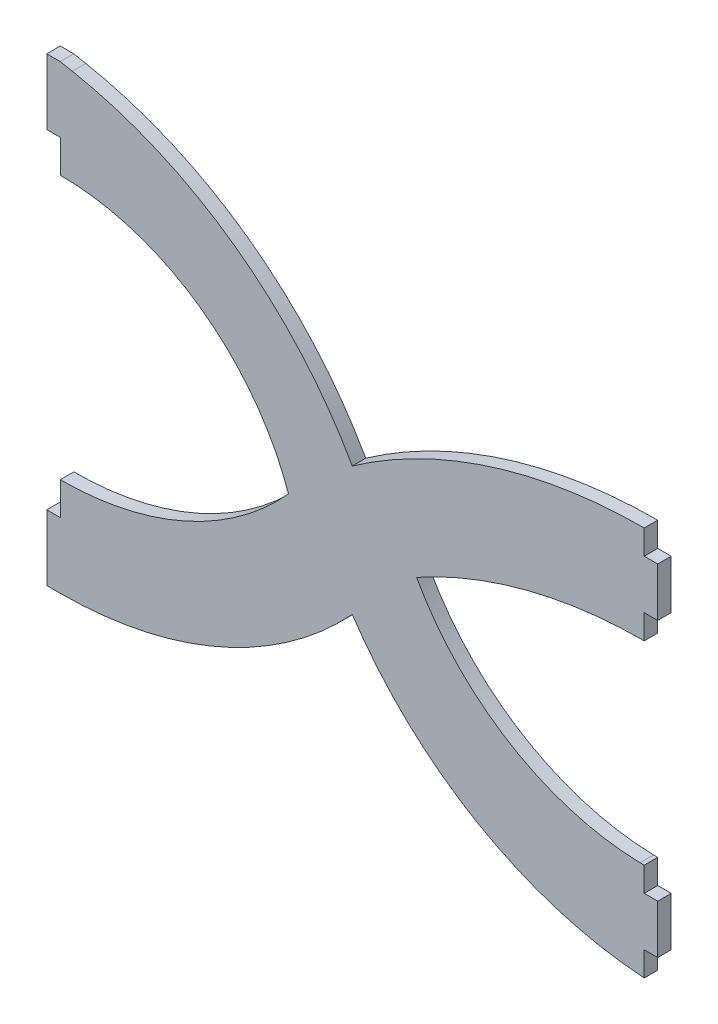
from build123d import *

# Parameters (mm, degrees)
SKETCH1_W           = 241.3
SKETCH1_H           = 198.12
BOSS_EXTRUDE1_DEPTH = 5.334
SKETCH2_W           = 5.334
SKETCH2_H           = 9.652
SKETCH2_H_2         = 96.012
SKETCH2_H_3         = 53.848
CUT_EXTRUDE1_DEPTH  = 179.277190048
SKETCH3_W           = 5.334
SKETCH3_H           = 16.256
SKETCH3_H_2         = 130.048
CUT_EXTRUDE2_DEPTH  = 179.277190048
CUT_EXTRUDE5_DEPTH  = 179.277190048
CUT_EXTRUDE6_DEPTH  = 179.277190048
CUT_EXTRUDE7_DEPTH  = 179.277190048


with BuildPart() as part:
    # Sketch1 → Boss-Extrude1 (new body)
    with BuildSketch(Plane.XY):
        with Locations((-21.329797884, -8.624919689)):
            Rectangle(SKETCH1_W, SKETCH1_H)
    extrude(amount=BOSS_EXTRUDE1_DEPTH)

    # Sketch2 → Cut-Extrude1 (cut, through all)
    with BuildSketch(Plane.XY.offset(5.334)):
        with Locations((96.653202116, -102.858919689)):
            Rectangle(SKETCH2_W, SKETCH2_H)
        with Locations((96.653202116, -30.722919689)):
            Rectangle(SKETCH2_W, SKETCH2_H_2)
        with Locations((96.653202116, 63.511080311)):
            Rectangle(SKETCH2_W, SKETCH2_H_3)
    extrude(amount=-CUT_EXTRUDE1_DEPTH, mode=Mode.SUBTRACT)

    # Sketch3 → Cut-Extrude2 (cut, through all)
    with BuildSketch(Plane.XY.offset(5.334)):
        with Locations((-139.312797884, -99.556919689)):
            Rectangle(SKETCH3_W, SKETCH3_H)
        with Locations((-139.312797884, -0.496919689)):
            Rectangle(SKETCH3_W, SKETCH3_H_2)
    extrude(amount=-CUT_EXTRUDE2_DEPTH, mode=Mode.SUBTRACT)

    # Sketch5 → Cut-Extrude5 (cut, through all)
    with BuildSketch(Plane.XY.offset(5.334)):
        Polygon((-136.645797884, -91.428919689), (93.986202116, -107.684919689), (93.986202116, -162.860416997), (-136.645797884, -146.604416997), align=None)
    extrude(amount=-CUT_EXTRUDE5_DEPTH, mode=Mode.SUBTRACT)

    # Sketch6 → Cut-Extrude6 (cut, through all)
    with BuildSketch(Plane.XY.offset(5.334)):
        Polygon((-136.645797884, 90.435080311), (93.986202116, 46.239080311), (93.986202116, 90.435080311), (-136.645797884, 134.631080311), align=None)
    extrude(amount=-CUT_EXTRUDE6_DEPTH, mode=Mode.SUBTRACT)

    # Sketch7 → Cut-Extrude7 (cut, through all)
    with BuildSketch(Plane.XY.offset(5.334)):
        with BuildLine():
            Line((-131.856906834, 89.51738533), (93.986202116, 46.239080311))
            ThreePointArc((93.986202116, 46.239080311), (33.516562096, 36.909943164), (-21.329797884, 9.790080311))
            ThreePointArc((-21.329797884, 9.790080311), (-67.771765334, 61.883225714), (-131.856906834, 89.51738533))
        make_face()
        with BuildLine():
            Line((-136.645797884, -91.428919689), (93.309248095, -107.637204869))
            ThreePointArc((93.309248095, -107.637204869), (28.257925694, -87.626912489), (-21.329797884, -41.009919689))
            ThreePointArc((-21.329797884, -41.009919689), (-73.717554191, -78.2732768), (-136.645797884, -91.428919689))
        make_face()
        with BuildLine():
            ThreePointArc((93.986202116, 7.631080311), (47.550679246, 1.726898301), (4.070202116, -15.609919689))
            ThreePointArc((4.070202116, -15.609919689), (41.092439587, -54.093369858), (92.347831876, -69.076919689))
            ThreePointArc((92.347831876, -69.076919689), (131.631647498, -31.544467715), (93.986202116, 7.631080311))
        make_face()
        with BuildLine():
            ThreePointArc((-136.645797884, 51.573080311), (-81.408536453, 33.982932584), (-46.514432981, -12.3092902))
            ThreePointArc((-46.514432981, -12.3092902), (-87.289086913, -42.04513502), (-136.645797884, -52.566919689))
            ThreePointArc((-136.645797884, -52.566919689), (-188.715797884, -0.496919689), (-136.645797884, 51.573080311))
        make_face()
    extrude(amount=-CUT_EXTRUDE7_DEPTH, mode=Mode.SUBTRACT)


solid = part.part
